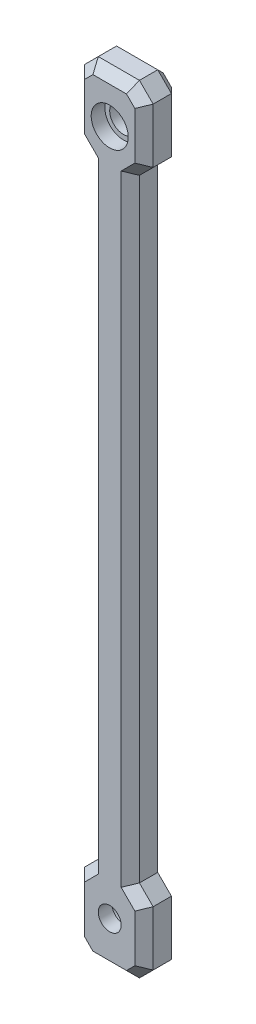
from build123d import *

# Parameters (mm, degrees)
SKETCH_1_R           = 2.5
SKETCH_1_R_2         = 4.05
EXTRUDE_1_DEPTH      = 8
CHAMFER_2_SIZE       = 3
EXTRUDE_2_DEPTH      = 1
EXTRUDE_2_DEPTH_BACK = 2
SKETCH_2_R           = 4.05
SKETCH_2_R_2         = 3
CHAMFER_3_SIZE       = 2
CHAMFER_4_SIZE       = 2
FILLET_1_R           = 0.5
FILLET_2_R           = 0.5
SKETCH_3_W           = 18.755341831
SKETCH_3_H           = 148.115808698
CUT_EXTRUDE_1_DEPTH  = 2
CHAMFER_5_SIZE       = 2
SKETCH_4_R           = 4.05
CUT_EXTRUDE_2_DEPTH  = 3
FILLET_3_R           = 0.5


# Some blends are built 0.0001 mm under size
with BuildPart() as part:
    # 草图1 → 凸台-拉伸1 (new body)
    with BuildSketch(Plane.XY):
        Polygon((-7.5, 70), (-4.5, 70), (-4.5, -70), (-7.5, -70), (-7.5, -85), (7.5, -85), (7.5, -70), (4.5, -70), (4.5, 70), (7.5, 70), (7.5, 85), (-7.5, 85), align=None)
        with Locations((0, -75)):
            Circle(SKETCH_1_R, mode=Mode.SUBTRACT)
        with Locations((0, 75)):
            Circle(SKETCH_1_R_2, mode=Mode.SUBTRACT)
    extrude(amount=EXTRUDE_1_DEPTH)

    # 倒角2
    chamfer_2_edges = [part.edges().sort_by_distance(p)[0] for p in [
        (-4.5, -70, 4),
        (4.5, -70, 4),
        (-4.5, 70, 4),
        (4.5, 70, 4),
    ]]
    chamfer(chamfer_2_edges, length=CHAMFER_2_SIZE - 0.0001)  # a hair under: the kernel refuses the full size
    chamfer_2_2_edges = [part.edges().sort_by_distance(p)[0] for p in [
        (7.5, -85, 4),
        (-7.5, -85, 4),
        (7.5, 85, 4),
        (-7.5, 85, 4),
    ]]
    chamfer(chamfer_2_2_edges, length=CHAMFER_2_SIZE)

    # 草图2 → 凸台-拉伸2 (add, two sides: drawn at the far end of the back side and taken through both)
    with BuildSketch(Plane.XY.offset(4).offset(-EXTRUDE_2_DEPTH_BACK)):
        with Locations((0, 75)):
            Circle(SKETCH_2_R)
        with Locations((0, 75)):
            Circle(SKETCH_2_R_2, mode=Mode.SUBTRACT)
    extrude(amount=EXTRUDE_2_DEPTH + EXTRUDE_2_DEPTH_BACK)

    # 倒角3
    # the kernel refuses this chamfer: 2 mm, written as the material it takes off along each edge
    with BuildSketch(Plane(origin=(-7.5, -64.856634024, 8), x_dir=(-0.027495876610586487, 0, -0.9996219169112968), z_dir=(0, -1, 0)), Plane(origin=(7.5, -87.143365976, 8), x_dir=(0.027495876610586487, 0, -0.9996219169112968), z_dir=(0, 1, 0)), Plane(origin=(7.5, 64.856634024, 8), x_dir=(0.027495876610586487, 0, -0.9996219169112968), z_dir=(0, 1, 0)), Plane(origin=(-7.5, 87.143365976, 8), x_dir=(-0.027495876610586487, 0, -0.9996219169112968), z_dir=(0, -1, 0))) as chamfer_3_piece_1:
        Polygon((CHAMFER_3_SIZE * 0.999621916911, CHAMFER_3_SIZE * 0.0274958766106), (-CHAMFER_3_SIZE * 0.0274958766106, CHAMFER_3_SIZE * 0.999621916911), (0, 0), align=None)
    extrude(amount=22.286731952, mode=Mode.SUBTRACT)
    with BuildSketch(Plane(origin=(-4.5, 72.143465976, 8), x_dir=(-0.027495876610586487, 0, -0.9996219169112968), z_dir=(0, -1, 0))) as chamfer_3_piece_2_section:
        Polygon((CHAMFER_3_SIZE * 0.999621916911, CHAMFER_3_SIZE * 0.0274958766106), (-CHAMFER_3_SIZE * 0.0274958766106, CHAMFER_3_SIZE * 0.999621916911), (0, 0), align=None)
    chamfer_3_piece_2 = extrude(amount=144.286931952, mode=Mode.PRIVATE)
    chamfer_3_piece_2 = split(chamfer_3_piece_2, bisect_by=Plane(origin=(29.327929184, 33.172170816, 7.338365808), z_dir=(-0.7071067811865471, -0.7071067811865479, 0)), keep=Keep.TOP, mode=Mode.PRIVATE)
    chamfer_3_piece_2 = split(chamfer_3_piece_2, bisect_by=Plane(origin=(29.327929184, -33.172170816, 7.338365808), z_dir=(-0.7071067811865472, 0.7071067811865479, 0)), keep=Keep.TOP, mode=Mode.PRIVATE)
    add(chamfer_3_piece_2, mode=Mode.SUBTRACT)
    with BuildSketch(Plane(origin=(4.5, -72.143465976, 8), x_dir=(0.027495876610586487, 0, -0.9996219169112968), z_dir=(0, 1, 0))) as chamfer_3_piece_3_section:
        Polygon((CHAMFER_3_SIZE * 0.999621916911, CHAMFER_3_SIZE * 0.0274958766106), (-CHAMFER_3_SIZE * 0.0274958766106, CHAMFER_3_SIZE * 0.999621916911), (0, 0), align=None)
    chamfer_3_piece_3 = extrude(amount=144.286931952, mode=Mode.PRIVATE)
    chamfer_3_piece_3 = split(chamfer_3_piece_3, bisect_by=Plane(origin=(-29.327929184, 33.172170816, 7.338365808), z_dir=(0.7071067811865471, -0.7071067811865479, 0)), keep=Keep.TOP, mode=Mode.PRIVATE)
    chamfer_3_piece_3 = split(chamfer_3_piece_3, bisect_by=Plane(origin=(-29.327929184, -33.172170816, 7.338365808), z_dir=(0.7071067811865472, 0.7071067811865479, 0)), keep=Keep.TOP, mode=Mode.PRIVATE)
    add(chamfer_3_piece_3, mode=Mode.SUBTRACT)
    with BuildSketch(Plane(origin=(-9.643365976, -85, 8), x_dir=(0, -0.02749587661058907, -0.9996219169112965), z_dir=(1, 0, 0)), Plane(origin=(9.643365976, 85, 8), x_dir=(0, 0.02749587661058907, -0.9996219169112965), z_dir=(-1, 0, 0))) as chamfer_3_piece_4:
        Polygon((CHAMFER_3_SIZE * 0.999621916911, CHAMFER_3_SIZE * 0.0274958766106), (-CHAMFER_3_SIZE * 0.0274958766106, CHAMFER_3_SIZE * 0.999621916911), (0, 0), align=None)
    extrude(amount=19.286731952, mode=Mode.SUBTRACT)
    with BuildSketch(Plane(origin=(-11.13690896, 78.36309104, 8), x_dir=(-0.019442520806016377, 0.019442520806016377, -0.9996219169112965), z_dir=(0.7071067811865476, 0.7071067811865476, 0)), Plane(origin=(0.86309104, 88.63690896, 8), x_dir=(0.019442520806015953, 0.019442520806015946, -0.9996219169112968), z_dir=(0.7071067811865475, -0.7071067811865476, 0))) as chamfer_3_piece_5:
        Polygon((CHAMFER_3_SIZE * 0.999621916911, -CHAMFER_3_SIZE * 0.0274958766106), (-CHAMFER_3_SIZE * 0.0274958766106, -CHAMFER_3_SIZE * 0.999621916911), (0, 0), align=None)
    extrude(amount=14.529372639, mode=Mode.SUBTRACT)
    with BuildSketch(Plane(origin=(-11.13690896, -78.36309104, 8), x_dir=(-0.019442520806016377, -0.019442520806016377, -0.9996219169112965), z_dir=(0.7071067811865476, -0.7071067811865476, 0)), Plane(origin=(0.86309104, -88.63690896, 8), x_dir=(0.019442520806015953, -0.019442520806015946, -0.9996219169112968), z_dir=(0.7071067811865475, 0.7071067811865476, 0))) as chamfer_3_piece_6:
        Polygon((CHAMFER_3_SIZE * 0.999621916911, CHAMFER_3_SIZE * 0.0274958766106), (-CHAMFER_3_SIZE * 0.0274958766106, CHAMFER_3_SIZE * 0.999621916911), (0, 0), align=None)
    extrude(amount=14.529372639, mode=Mode.SUBTRACT)
    with BuildSketch(Plane(origin=(-0.86309104, -63.36319104, 8), x_dir=(-0.01944252080601354, 0.019442520806013556, -0.9996219169112968), z_dir=(-0.7071067811865479, -0.7071067811865472, 0))) as chamfer_3_piece_7_section:
        Polygon((CHAMFER_3_SIZE * 0.999621916911, CHAMFER_3_SIZE * 0.0274958766106), (-CHAMFER_3_SIZE * 0.0274958766106, CHAMFER_3_SIZE * 0.999621916911), (0, 0), align=None)
    chamfer_3_piece_7 = extrude(amount=14.529231218, mode=Mode.PRIVATE)
    chamfer_3_piece_7 = split(chamfer_3_piece_7, bisect_by=Plane(origin=(-4.5, -68.843566402, 7.247508302), z_dir=(-1, 0, 0)), keep=Keep.TOP, mode=Mode.PRIVATE)
    add(chamfer_3_piece_7, mode=Mode.SUBTRACT)
    with BuildSketch(Plane(origin=(11.13680896, -73.63690896, 8), x_dir=(0.019442520806015506, 0.019442520806015526, -0.9996219169112968), z_dir=(-0.7071067811865479, 0.7071067811865472, 0))) as chamfer_3_piece_8_section:
        Polygon((CHAMFER_3_SIZE * 0.999621916911, CHAMFER_3_SIZE * 0.0274958766106), (-CHAMFER_3_SIZE * 0.0274958766106, CHAMFER_3_SIZE * 0.999621916911), (0, 0), align=None)
    chamfer_3_piece_8 = extrude(amount=14.529231218, mode=Mode.PRIVATE)
    chamfer_3_piece_8 = split(chamfer_3_piece_8, bisect_by=Plane(origin=(4.5, -72.06712973, 7.36381375), z_dir=(1, 0, 0)), keep=Keep.TOP, mode=Mode.PRIVATE)
    add(chamfer_3_piece_8, mode=Mode.SUBTRACT)
    with BuildSketch(Plane(origin=(-11.13680896, 73.63690896, 8), x_dir=(-0.019442520806015506, -0.019442520806015526, -0.9996219169112968), z_dir=(0.7071067811865479, -0.7071067811865471, 0))) as chamfer_3_piece_9_section:
        Polygon((CHAMFER_3_SIZE * 0.999621916911, CHAMFER_3_SIZE * 0.0274958766106), (-CHAMFER_3_SIZE * 0.0274958766106, CHAMFER_3_SIZE * 0.999621916911), (0, 0), align=None)
    chamfer_3_piece_9 = extrude(amount=14.529231218, mode=Mode.PRIVATE)
    chamfer_3_piece_9 = split(chamfer_3_piece_9, bisect_by=Plane(origin=(-4.5, 72.06712973, 7.36381375), z_dir=(-1, 0, 0)), keep=Keep.TOP, mode=Mode.PRIVATE)
    add(chamfer_3_piece_9, mode=Mode.SUBTRACT)
    with BuildSketch(Plane(origin=(0.86309104, 63.36319104, 8), x_dir=(0.019442520806013806, -0.019442520806013826, -0.9996219169112968), z_dir=(0.7071067811865479, 0.7071067811865471, 0))) as chamfer_3_piece_10_section:
        Polygon((CHAMFER_3_SIZE * 0.999621916911, CHAMFER_3_SIZE * 0.0274958766106), (-CHAMFER_3_SIZE * 0.0274958766106, CHAMFER_3_SIZE * 0.999621916911), (0, 0), align=None)
    chamfer_3_piece_10 = extrude(amount=14.529231218, mode=Mode.PRIVATE)
    chamfer_3_piece_10 = split(chamfer_3_piece_10, bisect_by=Plane(origin=(4.5, 68.843566402, 7.247508302), z_dir=(1, 0, 0)), keep=Keep.TOP, mode=Mode.PRIVATE)
    add(chamfer_3_piece_10, mode=Mode.SUBTRACT)
    with BuildSketch(Plane(origin=(-11.13680896, 73.63690896, 8), x_dir=(-0.019442520806015506, -0.019442520806015526, -0.9996219169112968), z_dir=(0.7071067811865479, -0.7071067811865471, 0))) as chamfer_3_piece_11a_section:
        Polygon((CHAMFER_3_SIZE * 0.999621916911, CHAMFER_3_SIZE * 0.0274958766106), (-CHAMFER_3_SIZE * 0.0274958766106, CHAMFER_3_SIZE * 0.999621916911), (0, 0), align=None)
    chamfer_3_piece_11a = extrude(amount=14.529231218, mode=Mode.PRIVATE)
    chamfer_3_piece_11a = split(chamfer_3_piece_11a, bisect_by=Plane(origin=(-4.5, 65.927671271, 7.36381375), z_dir=(1, 0, 0)), keep=Keep.TOP, mode=Mode.PRIVATE)
    with BuildSketch(Plane(origin=(-4.5, 72.143465976, 8), x_dir=(-0.027495876610586487, 0, -0.9996219169112968), z_dir=(0, -1, 0))) as chamfer_3_piece_11b_section:
        Polygon((CHAMFER_3_SIZE * 0.999621916911, CHAMFER_3_SIZE * 0.0274958766106), (-CHAMFER_3_SIZE * 0.0274958766106, CHAMFER_3_SIZE * 0.999621916911), (0, 0), align=None)
    chamfer_3_piece_11b = extrude(amount=144.286931952, mode=Mode.PRIVATE)
    chamfer_3_piece_11b = split(chamfer_3_piece_11b, bisect_by=Plane(origin=(-5.258321627, 67.758421627, 7.36381375), z_dir=(0.7071067811865471, 0.7071067811865479, 0)), keep=Keep.TOP, mode=Mode.PRIVATE)
    chamfer_3_piece_11 = chamfer_3_piece_11a & chamfer_3_piece_11b
    add(chamfer_3_piece_11, mode=Mode.SUBTRACT)
    with BuildSketch(Plane(origin=(-4.5, 72.143465976, 8), x_dir=(-0.027495876610586487, 0, -0.9996219169112968), z_dir=(0, -1, 0))) as chamfer_3_piece_12a_section:
        Polygon((CHAMFER_3_SIZE * 0.999621916911, CHAMFER_3_SIZE * 0.0274958766106), (-CHAMFER_3_SIZE * 0.0274958766106, CHAMFER_3_SIZE * 0.999621916911), (0, 0), align=None)
    chamfer_3_piece_12a = extrude(amount=144.286931952, mode=Mode.PRIVATE)
    chamfer_3_piece_12a = split(chamfer_3_piece_12a, bisect_by=Plane(origin=(-5.258321627, -67.758421627, 7.36381375), z_dir=(0.7071067811865472, -0.7071067811865479, 0)), keep=Keep.TOP, mode=Mode.PRIVATE)
    with BuildSketch(Plane(origin=(-0.86309104, -63.36319104, 8), x_dir=(-0.01944252080601354, 0.019442520806013556, -0.9996219169112968), z_dir=(-0.7071067811865479, -0.7071067811865472, 0))) as chamfer_3_piece_12b_section:
        Polygon((CHAMFER_3_SIZE * 0.999621916911, CHAMFER_3_SIZE * 0.0274958766106), (-CHAMFER_3_SIZE * 0.0274958766106, CHAMFER_3_SIZE * 0.999621916911), (0, 0), align=None)
    chamfer_3_piece_12b = extrude(amount=14.529231218, mode=Mode.PRIVATE)
    chamfer_3_piece_12b = split(chamfer_3_piece_12b, bisect_by=Plane(origin=(-4.5, -65.927671271, 7.36381375), z_dir=(1, 0, 0)), keep=Keep.TOP, mode=Mode.PRIVATE)
    chamfer_3_piece_12 = chamfer_3_piece_12a & chamfer_3_piece_12b
    add(chamfer_3_piece_12, mode=Mode.SUBTRACT)
    with BuildSketch(Plane(origin=(4.5, -72.143465976, 8), x_dir=(0.027495876610586487, 0, -0.9996219169112968), z_dir=(0, 1, 0))) as chamfer_3_piece_13a_section:
        Polygon((CHAMFER_3_SIZE * 0.999621916911, CHAMFER_3_SIZE * 0.0274958766106), (-CHAMFER_3_SIZE * 0.0274958766106, CHAMFER_3_SIZE * 0.999621916911), (0, 0), align=None)
    chamfer_3_piece_13a = extrude(amount=144.286931952, mode=Mode.PRIVATE)
    chamfer_3_piece_13a = split(chamfer_3_piece_13a, bisect_by=Plane(origin=(5.258321627, -67.758421627, 7.36381375), z_dir=(-0.7071067811865472, -0.7071067811865479, 0)), keep=Keep.TOP, mode=Mode.PRIVATE)
    with BuildSketch(Plane(origin=(11.13680896, -73.63690896, 8), x_dir=(0.019442520806015506, 0.019442520806015526, -0.9996219169112968), z_dir=(-0.7071067811865479, 0.7071067811865472, 0))) as chamfer_3_piece_13b_section:
        Polygon((CHAMFER_3_SIZE * 0.999621916911, CHAMFER_3_SIZE * 0.0274958766106), (-CHAMFER_3_SIZE * 0.0274958766106, CHAMFER_3_SIZE * 0.999621916911), (0, 0), align=None)
    chamfer_3_piece_13b = extrude(amount=14.529231218, mode=Mode.PRIVATE)
    chamfer_3_piece_13b = split(chamfer_3_piece_13b, bisect_by=Plane(origin=(4.5, -65.927671271, 7.36381375), z_dir=(-1, 0, 0)), keep=Keep.TOP, mode=Mode.PRIVATE)
    chamfer_3_piece_13 = chamfer_3_piece_13a & chamfer_3_piece_13b
    add(chamfer_3_piece_13, mode=Mode.SUBTRACT)
    with BuildSketch(Plane(origin=(0.86309104, 63.36319104, 8), x_dir=(0.019442520806013806, -0.019442520806013826, -0.9996219169112968), z_dir=(0.7071067811865479, 0.7071067811865471, 0))) as chamfer_3_piece_14a_section:
        Polygon((CHAMFER_3_SIZE * 0.999621916911, CHAMFER_3_SIZE * 0.0274958766106), (-CHAMFER_3_SIZE * 0.0274958766106, CHAMFER_3_SIZE * 0.999621916911), (0, 0), align=None)
    chamfer_3_piece_14a = extrude(amount=14.529231218, mode=Mode.PRIVATE)
    chamfer_3_piece_14a = split(chamfer_3_piece_14a, bisect_by=Plane(origin=(4.5, 65.927671271, 7.36381375), z_dir=(-1, 0, 0)), keep=Keep.TOP, mode=Mode.PRIVATE)
    with BuildSketch(Plane(origin=(4.5, -72.143465976, 8), x_dir=(0.027495876610586487, 0, -0.9996219169112968), z_dir=(0, 1, 0))) as chamfer_3_piece_14b_section:
        Polygon((CHAMFER_3_SIZE * 0.999621916911, CHAMFER_3_SIZE * 0.0274958766106), (-CHAMFER_3_SIZE * 0.0274958766106, CHAMFER_3_SIZE * 0.999621916911), (0, 0), align=None)
    chamfer_3_piece_14b = extrude(amount=144.286931952, mode=Mode.PRIVATE)
    chamfer_3_piece_14b = split(chamfer_3_piece_14b, bisect_by=Plane(origin=(5.258321627, 67.758421627, 7.36381375), z_dir=(-0.7071067811865471, 0.7071067811865479, 0)), keep=Keep.TOP, mode=Mode.PRIVATE)
    chamfer_3_piece_14 = chamfer_3_piece_14a & chamfer_3_piece_14b
    add(chamfer_3_piece_14, mode=Mode.SUBTRACT)

    # 倒角4
    # the kernel refuses this chamfer: 2 mm, written as the material it takes off along each edge
    with BuildSketch(Plane(origin=(-7.5, -64.856634024, 0), x_dir=(0.9996219169112968, 0, -0.027495876610586365), z_dir=(0, -1, 0)), Plane(origin=(7.5, 64.856634024, 0), x_dir=(-0.9996219169112968, 0, -0.027495876610586365), z_dir=(0, 1, 0)), Plane(origin=(7.5, -87.143365976, 0), x_dir=(-0.9996219169112968, 0, -0.027495876610586365), z_dir=(0, 1, 0)), Plane(origin=(-7.5, 87.143365976, 0), x_dir=(0.9996219169112968, 0, -0.027495876610586365), z_dir=(0, -1, 0))) as chamfer_4_piece_1:
        Polygon((CHAMFER_4_SIZE * 0.999621916911, CHAMFER_4_SIZE * 0.0274958766106), (-CHAMFER_4_SIZE * 0.0274958766106, CHAMFER_4_SIZE * 0.999621916911), (0, 0), align=None)
    extrude(amount=22.286731952, mode=Mode.SUBTRACT)
    with BuildSketch(Plane(origin=(-4.5, 72.143465976, 0), x_dir=(0.9996219169112968, 0, -0.027495876610586372), z_dir=(0, -1, 0))) as chamfer_4_piece_2_section:
        Polygon((CHAMFER_4_SIZE * 0.999621916911, CHAMFER_4_SIZE * 0.0274958766106), (-CHAMFER_4_SIZE * 0.0274958766106, CHAMFER_4_SIZE * 0.999621916911), (0, 0), align=None)
    chamfer_4_piece_2 = extrude(amount=144.286931952, mode=Mode.PRIVATE)
    chamfer_4_piece_2 = split(chamfer_4_piece_2, bisect_by=Plane(origin=(29.327929184, -33.172170816, 0.661634192), z_dir=(-0.7071067811865472, 0.7071067811865479, 0)), keep=Keep.TOP, mode=Mode.PRIVATE)
    chamfer_4_piece_2 = split(chamfer_4_piece_2, bisect_by=Plane(origin=(29.327929184, 33.172170816, 0.661634192), z_dir=(-0.7071067811865471, -0.7071067811865479, 0)), keep=Keep.TOP, mode=Mode.PRIVATE)
    add(chamfer_4_piece_2, mode=Mode.SUBTRACT)
    with BuildSketch(Plane(origin=(4.5, -72.143465976, 0), x_dir=(-0.9996219169112968, 0, -0.027495876610586372), z_dir=(0, 1, 0))) as chamfer_4_piece_3_section:
        Polygon((CHAMFER_4_SIZE * 0.999621916911, CHAMFER_4_SIZE * 0.0274958766106), (-CHAMFER_4_SIZE * 0.0274958766106, CHAMFER_4_SIZE * 0.999621916911), (0, 0), align=None)
    chamfer_4_piece_3 = extrude(amount=144.286931952, mode=Mode.PRIVATE)
    chamfer_4_piece_3 = split(chamfer_4_piece_3, bisect_by=Plane(origin=(-29.327929184, -33.172170816, 0.661634192), z_dir=(0.7071067811865472, 0.7071067811865479, 0)), keep=Keep.TOP, mode=Mode.PRIVATE)
    chamfer_4_piece_3 = split(chamfer_4_piece_3, bisect_by=Plane(origin=(-29.327929184, 33.172170816, 0.661634192), z_dir=(0.7071067811865471, -0.7071067811865479, 0)), keep=Keep.TOP, mode=Mode.PRIVATE)
    add(chamfer_4_piece_3, mode=Mode.SUBTRACT)
    with BuildSketch(Plane(origin=(-9.643365976, -85, 0), x_dir=(0, 0.9996219169112968, -0.027495876610586292), z_dir=(1, 0, 0)), Plane(origin=(9.643365976, 85, 0), x_dir=(0, -0.9996219169112968, -0.027495876610586292), z_dir=(-1, 0, 0))) as chamfer_4_piece_4:
        Polygon((CHAMFER_4_SIZE * 0.999621916911, CHAMFER_4_SIZE * 0.0274958766106), (-CHAMFER_4_SIZE * 0.0274958766106, CHAMFER_4_SIZE * 0.999621916911), (0, 0), align=None)
    extrude(amount=19.286731952, mode=Mode.SUBTRACT)
    with BuildSketch(Plane(origin=(-11.13690896, 78.36309104, 0), x_dir=(0.7068394360706736, -0.7068394360706736, -0.02749587661058632), z_dir=(0.7071067811865476, 0.7071067811865476, 0)), Plane(origin=(0.86309104, 88.63690896, 0), x_dir=(-0.7068394360706736, -0.7068394360706735, -0.027495876610586348), z_dir=(0.7071067811865475, -0.7071067811865476, 0))) as chamfer_4_piece_5:
        Polygon((CHAMFER_4_SIZE * 0.999621916911, -CHAMFER_4_SIZE * 0.0274958766106), (-CHAMFER_4_SIZE * 0.0274958766106, -CHAMFER_4_SIZE * 0.999621916911), (0, 0), align=None)
    extrude(amount=14.529372639, mode=Mode.SUBTRACT)
    with BuildSketch(Plane(origin=(-11.13690896, -78.36309104, 0), x_dir=(0.7068394360706736, 0.7068394360706736, -0.02749587661058632), z_dir=(0.7071067811865476, -0.7071067811865476, 0)), Plane(origin=(0.86309104, -88.63690896, 0), x_dir=(-0.7068394360706736, 0.7068394360706735, -0.027495876610586348), z_dir=(0.7071067811865475, 0.7071067811865476, 0))) as chamfer_4_piece_6:
        Polygon((CHAMFER_4_SIZE * 0.999621916911, CHAMFER_4_SIZE * 0.0274958766106), (-CHAMFER_4_SIZE * 0.0274958766106, CHAMFER_4_SIZE * 0.999621916911), (0, 0), align=None)
    extrude(amount=14.529372639, mode=Mode.SUBTRACT)
    with BuildSketch(Plane(origin=(-0.86309104, -63.36319104, 0), x_dir=(0.7068394360706732, -0.7068394360706739, -0.027495876610586244), z_dir=(-0.7071067811865479, -0.7071067811865472, 0))) as chamfer_4_piece_7_section:
        Polygon((CHAMFER_4_SIZE * 0.999621916911, CHAMFER_4_SIZE * 0.0274958766106), (-CHAMFER_4_SIZE * 0.0274958766106, CHAMFER_4_SIZE * 0.999621916911), (0, 0), align=None)
    chamfer_4_piece_7 = extrude(amount=14.529231218, mode=Mode.PRIVATE)
    chamfer_4_piece_7 = split(chamfer_4_piece_7, bisect_by=Plane(origin=(-4.5, -68.843566402, 0.752491698), z_dir=(-1, 0, 0)), keep=Keep.TOP, mode=Mode.PRIVATE)
    add(chamfer_4_piece_7, mode=Mode.SUBTRACT)
    with BuildSketch(Plane(origin=(11.13680896, -73.63690896, 0), x_dir=(-0.7068394360706731, -0.7068394360706738, -0.027495876610586365), z_dir=(-0.7071067811865479, 0.7071067811865472, 0))) as chamfer_4_piece_8_section:
        Polygon((CHAMFER_4_SIZE * 0.999621916911, CHAMFER_4_SIZE * 0.0274958766106), (-CHAMFER_4_SIZE * 0.0274958766106, CHAMFER_4_SIZE * 0.999621916911), (0, 0), align=None)
    chamfer_4_piece_8 = extrude(amount=14.529231218, mode=Mode.PRIVATE)
    chamfer_4_piece_8 = split(chamfer_4_piece_8, bisect_by=Plane(origin=(4.5, -72.06712973, 0.63618625), z_dir=(1, 0, 0)), keep=Keep.TOP, mode=Mode.PRIVATE)
    add(chamfer_4_piece_8, mode=Mode.SUBTRACT)
    with BuildSketch(Plane(origin=(-11.13680896, 73.63690896, 0), x_dir=(0.706839436070673, 0.7068394360706739, -0.027495876610586376), z_dir=(0.7071067811865479, -0.7071067811865471, 0))) as chamfer_4_piece_9_section:
        Polygon((CHAMFER_4_SIZE * 0.999621916911, CHAMFER_4_SIZE * 0.0274958766106), (-CHAMFER_4_SIZE * 0.0274958766106, CHAMFER_4_SIZE * 0.999621916911), (0, 0), align=None)
    chamfer_4_piece_9 = extrude(amount=14.529231218, mode=Mode.PRIVATE)
    chamfer_4_piece_9 = split(chamfer_4_piece_9, bisect_by=Plane(origin=(-4.5, 72.06712973, 0.63618625), z_dir=(-1, 0, 0)), keep=Keep.TOP, mode=Mode.PRIVATE)
    add(chamfer_4_piece_9, mode=Mode.SUBTRACT)
    with BuildSketch(Plane(origin=(0.86309104, 63.36319104, 0), x_dir=(-0.7068394360706732, 0.7068394360706739, -0.02749587661058627), z_dir=(0.7071067811865479, 0.7071067811865471, 0))) as chamfer_4_piece_10_section:
        Polygon((CHAMFER_4_SIZE * 0.999621916911, CHAMFER_4_SIZE * 0.0274958766106), (-CHAMFER_4_SIZE * 0.0274958766106, CHAMFER_4_SIZE * 0.999621916911), (0, 0), align=None)
    chamfer_4_piece_10 = extrude(amount=14.529231218, mode=Mode.PRIVATE)
    chamfer_4_piece_10 = split(chamfer_4_piece_10, bisect_by=Plane(origin=(4.5, 68.843566402, 0.752491698), z_dir=(1, 0, 0)), keep=Keep.TOP, mode=Mode.PRIVATE)
    add(chamfer_4_piece_10, mode=Mode.SUBTRACT)
    with BuildSketch(Plane(origin=(-11.13680896, 73.63690896, 0), x_dir=(0.706839436070673, 0.7068394360706739, -0.027495876610586376), z_dir=(0.7071067811865479, -0.7071067811865471, 0))) as chamfer_4_piece_11a_section:
        Polygon((CHAMFER_4_SIZE * 0.999621916911, CHAMFER_4_SIZE * 0.0274958766106), (-CHAMFER_4_SIZE * 0.0274958766106, CHAMFER_4_SIZE * 0.999621916911), (0, 0), align=None)
    chamfer_4_piece_11a = extrude(amount=14.529231218, mode=Mode.PRIVATE)
    chamfer_4_piece_11a = split(chamfer_4_piece_11a, bisect_by=Plane(origin=(-4.5, 65.927671271, 0.63618625), z_dir=(1, 0, 0)), keep=Keep.TOP, mode=Mode.PRIVATE)
    with BuildSketch(Plane(origin=(-4.5, 72.143465976, 0), x_dir=(0.9996219169112968, 0, -0.027495876610586372), z_dir=(0, -1, 0))) as chamfer_4_piece_11b_section:
        Polygon((CHAMFER_4_SIZE * 0.999621916911, CHAMFER_4_SIZE * 0.0274958766106), (-CHAMFER_4_SIZE * 0.0274958766106, CHAMFER_4_SIZE * 0.999621916911), (0, 0), align=None)
    chamfer_4_piece_11b = extrude(amount=144.286931952, mode=Mode.PRIVATE)
    chamfer_4_piece_11b = split(chamfer_4_piece_11b, bisect_by=Plane(origin=(-5.258321627, 67.758421627, 0.63618625), z_dir=(0.7071067811865471, 0.7071067811865479, 0)), keep=Keep.TOP, mode=Mode.PRIVATE)
    chamfer_4_piece_11 = chamfer_4_piece_11a & chamfer_4_piece_11b
    add(chamfer_4_piece_11, mode=Mode.SUBTRACT)
    with BuildSketch(Plane(origin=(-4.5, 72.143465976, 0), x_dir=(0.9996219169112968, 0, -0.027495876610586372), z_dir=(0, -1, 0))) as chamfer_4_piece_12a_section:
        Polygon((CHAMFER_4_SIZE * 0.999621916911, CHAMFER_4_SIZE * 0.0274958766106), (-CHAMFER_4_SIZE * 0.0274958766106, CHAMFER_4_SIZE * 0.999621916911), (0, 0), align=None)
    chamfer_4_piece_12a = extrude(amount=144.286931952, mode=Mode.PRIVATE)
    chamfer_4_piece_12a = split(chamfer_4_piece_12a, bisect_by=Plane(origin=(-5.258321627, -67.758421627, 0.63618625), z_dir=(0.7071067811865472, -0.7071067811865479, 0)), keep=Keep.TOP, mode=Mode.PRIVATE)
    with BuildSketch(Plane(origin=(-0.86309104, -63.36319104, 0), x_dir=(0.7068394360706732, -0.7068394360706739, -0.027495876610586244), z_dir=(-0.7071067811865479, -0.7071067811865472, 0))) as chamfer_4_piece_12b_section:
        Polygon((CHAMFER_4_SIZE * 0.999621916911, CHAMFER_4_SIZE * 0.0274958766106), (-CHAMFER_4_SIZE * 0.0274958766106, CHAMFER_4_SIZE * 0.999621916911), (0, 0), align=None)
    chamfer_4_piece_12b = extrude(amount=14.529231218, mode=Mode.PRIVATE)
    chamfer_4_piece_12b = split(chamfer_4_piece_12b, bisect_by=Plane(origin=(-4.5, -65.927671271, 0.63618625), z_dir=(1, 0, 0)), keep=Keep.TOP, mode=Mode.PRIVATE)
    chamfer_4_piece_12 = chamfer_4_piece_12a & chamfer_4_piece_12b
    add(chamfer_4_piece_12, mode=Mode.SUBTRACT)
    with BuildSketch(Plane(origin=(4.5, -72.143465976, 0), x_dir=(-0.9996219169112968, 0, -0.027495876610586372), z_dir=(0, 1, 0))) as chamfer_4_piece_13a_section:
        Polygon((CHAMFER_4_SIZE * 0.999621916911, CHAMFER_4_SIZE * 0.0274958766106), (-CHAMFER_4_SIZE * 0.0274958766106, CHAMFER_4_SIZE * 0.999621916911), (0, 0), align=None)
    chamfer_4_piece_13a = extrude(amount=144.286931952, mode=Mode.PRIVATE)
    chamfer_4_piece_13a = split(chamfer_4_piece_13a, bisect_by=Plane(origin=(5.258321627, -67.758421627, 0.63618625), z_dir=(-0.7071067811865472, -0.7071067811865479, 0)), keep=Keep.TOP, mode=Mode.PRIVATE)
    with BuildSketch(Plane(origin=(11.13680896, -73.63690896, 0), x_dir=(-0.7068394360706731, -0.7068394360706738, -0.027495876610586365), z_dir=(-0.7071067811865479, 0.7071067811865472, 0))) as chamfer_4_piece_13b_section:
        Polygon((CHAMFER_4_SIZE * 0.999621916911, CHAMFER_4_SIZE * 0.0274958766106), (-CHAMFER_4_SIZE * 0.0274958766106, CHAMFER_4_SIZE * 0.999621916911), (0, 0), align=None)
    chamfer_4_piece_13b = extrude(amount=14.529231218, mode=Mode.PRIVATE)
    chamfer_4_piece_13b = split(chamfer_4_piece_13b, bisect_by=Plane(origin=(4.5, -65.927671271, 0.63618625), z_dir=(-1, 0, 0)), keep=Keep.TOP, mode=Mode.PRIVATE)
    chamfer_4_piece_13 = chamfer_4_piece_13a & chamfer_4_piece_13b
    add(chamfer_4_piece_13, mode=Mode.SUBTRACT)
    with BuildSketch(Plane(origin=(0.86309104, 63.36319104, 0), x_dir=(-0.7068394360706732, 0.7068394360706739, -0.02749587661058627), z_dir=(0.7071067811865479, 0.7071067811865471, 0))) as chamfer_4_piece_14a_section:
        Polygon((CHAMFER_4_SIZE * 0.999621916911, CHAMFER_4_SIZE * 0.0274958766106), (-CHAMFER_4_SIZE * 0.0274958766106, CHAMFER_4_SIZE * 0.999621916911), (0, 0), align=None)
    chamfer_4_piece_14a = extrude(amount=14.529231218, mode=Mode.PRIVATE)
    chamfer_4_piece_14a = split(chamfer_4_piece_14a, bisect_by=Plane(origin=(4.5, 65.927671271, 0.63618625), z_dir=(-1, 0, 0)), keep=Keep.TOP, mode=Mode.PRIVATE)
    with BuildSketch(Plane(origin=(4.5, -72.143465976, 0), x_dir=(-0.9996219169112968, 0, -0.027495876610586372), z_dir=(0, 1, 0))) as chamfer_4_piece_14b_section:
        Polygon((CHAMFER_4_SIZE * 0.999621916911, CHAMFER_4_SIZE * 0.0274958766106), (-CHAMFER_4_SIZE * 0.0274958766106, CHAMFER_4_SIZE * 0.999621916911), (0, 0), align=None)
    chamfer_4_piece_14b = extrude(amount=144.286931952, mode=Mode.PRIVATE)
    chamfer_4_piece_14b = split(chamfer_4_piece_14b, bisect_by=Plane(origin=(5.258321627, 67.758421627, 0.63618625), z_dir=(-0.7071067811865471, 0.7071067811865479, 0)), keep=Keep.TOP, mode=Mode.PRIVATE)
    chamfer_4_piece_14 = chamfer_4_piece_14a & chamfer_4_piece_14b
    add(chamfer_4_piece_14, mode=Mode.SUBTRACT)

    # 圆角1
    fillet_1_edges = [part.edges().sort_by_distance(p)[0] for p in [
        (-4.05, 75, 0),
    ]]
    fillet(fillet_1_edges, radius=FILLET_1_R)

    # 圆角2
    fillet_2_edges = [part.edges().sort_by_distance(p)[0] for p in [
        (-2.5, -75, 0),
    ]]
    fillet(fillet_2_edges, radius=FILLET_2_R)

    # 草图3 → 切除-拉伸1 (cut)
    with BuildSketch(Plane(origin=(0, 0, 0), x_dir=(-1, 0, 0), z_dir=(0, 0, -1))):
        with Locations((0.058364989, -12.057904349)):
            Rectangle(SKETCH_3_W, SKETCH_3_H)
    extrude(amount=-CUT_EXTRUDE_1_DEPTH, mode=Mode.SUBTRACT)

    # 倒角5
    chamfer_5_edges = [part.edges().sort_by_distance(p)[0] for p in [
        (0, 62, 2),
    ]]
    chamfer(chamfer_5_edges, length=CHAMFER_5_SIZE - 0.0001)  # a hair under: the kernel refuses the full size

    # 草图4 → 切除-拉伸2 (cut)
    with BuildSketch(Plane(origin=(0, 0, 2), x_dir=(-1, 0, 0), z_dir=(0, 0, -1))):
        with Locations((0, -75)):
            Circle(SKETCH_4_R)
    extrude(amount=-CUT_EXTRUDE_2_DEPTH, mode=Mode.SUBTRACT)

    # 圆角3
    fillet_3_edges = [part.edges().sort_by_distance(p)[0] for p in [
        (4.05, -75, 2),
    ]]
    fillet(fillet_3_edges, radius=FILLET_3_R)


solid = part.part
